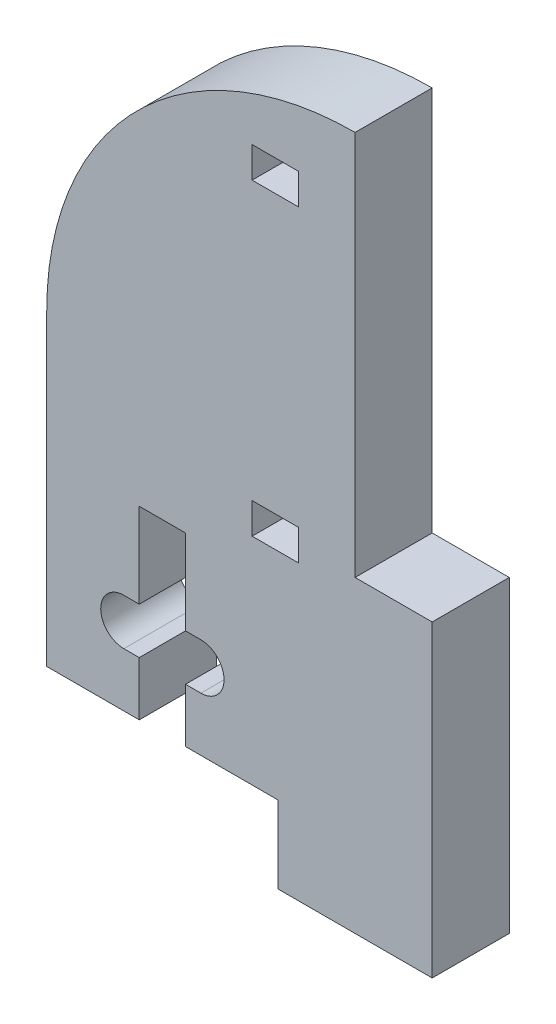
from build123d import *

# Parameters (mm, degrees)
SKETCH1_W           = 3
SKETCH1_H           = 2
BOSS_EXTRUDE1_DEPTH = 5
SKETCH2_W           = 3
SKETCH2_H           = 12
CUT_EXTRUDE1_DEPTH  = 10


with BuildPart() as part:
    # Sketch1 → Boss-Extrude1 (new body)
    with BuildSketch(Plane.XY):
        with BuildLine():
            Line((15, -25), (15, -5))
            Line((15, -5), (10, -5))
            Line((10, -5), (10, 20))
            ThreePointArc((10, 20), (-4.142135624, 14.142135624), (-10, 0))
            Line((-10, 0), (-10, -20))
            Line((-10, -20), (5, -20))
            Line((5, -20), (5, -25))
            Line((5, -25), (15, -25))
        make_face()
        with Locations((4.821732665, 14.979619094)):
            Rectangle(SKETCH1_W, SKETCH1_H, mode=Mode.SUBTRACT)
        with Locations((4.821732665, -5.020380906)):
            Rectangle(SKETCH1_W, SKETCH1_H, mode=Mode.SUBTRACT)
    extrude(amount=BOSS_EXTRUDE1_DEPTH)

    # Sketch2 → Cut-Extrude1 (cut)
    with BuildSketch(Plane.XY.offset(5)):
        with Locations((-2.5, -14)):
            Rectangle(SKETCH2_W, SKETCH2_H)
        with BuildLine():
            Line((-5, -13.5), (0, -13.5))
            ThreePointArc((0, -13.5), (1.5, -15), (0, -16.5))
            Line((0, -16.5), (-5, -16.5))
            ThreePointArc((-5, -16.5), (-6.5, -15), (-5, -13.5))
        make_face()
    extrude(amount=-CUT_EXTRUDE1_DEPTH, mode=Mode.SUBTRACT)


solid = part.part
